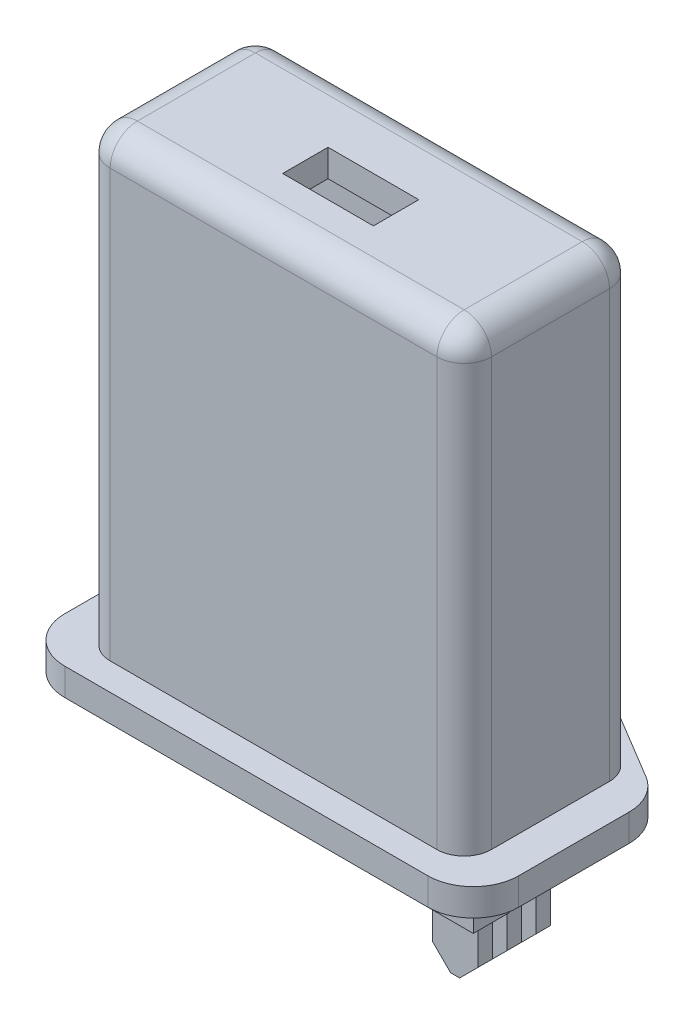
from build123d import *

# Parameters (mm, degrees)
BOSS_EXTRUDE1_DEPTH   = 0.3
EXTRUDE_THIN1_DEPTH   = 5
EXTRUDE_THIN1_2_DEPTH = 0.3
EXTRUDE_THIN1_START   = 4.7
EXTRUDE_THIN1_3_DEPTH = 0.3
FILLET2_R             = 0.3
CUT_EXTRUDE2_REACH    = 8.308
SKETCH5_W             = 1
SKETCH5_H             = 0.5
SKETCH6_W             = 0.7
SKETCH6_H             = 0.4
SKETCH6_W_2           = 0.5
SKETCH6_H_2           = 0.8
CUT_EXTRUDE3_DEPTH    = 0.2
CUT_EXTRUDE4_DEPTH    = 0.1
BOSS_EXTRUDE2_DEPTH   = 3
CHAMFER1_SIZE         = 0.2
SKETCH9_W             = 0.7
SKETCH9_H             = 0.4
BOSS_EXTRUDE3_DEPTH   = 1
SKETCH10_W            = 0.3
SKETCH10_H            = 0.2
CUT_EXTRUDE5_DEPTH    = 0.3
SKETCH11_R            = 0.07
CUT_EXTRUDE6_DEPTH    = 1


# Read off the part's stored shape, not the designer's step: Extrude-Thin1
with BuildPart() as part:
    # Sketch2 → Boss-Extrude1 (new body)
    with BuildSketch(Plane(origin=(0, 0, 0), x_dir=(1, 0, 0), z_dir=(0, 1, 0))):
        with BuildLine():
            Line((-2.257247878, 1.145651273), (-0.514495755, 2.191302547))
            ThreePointArc((-0.514495755, 2.191302547), (0, 2.333809621), (0.514495755, 2.191302547))
            Line((0.514495755, 2.191302547), (2.257247878, 1.145651273))
            ThreePointArc((2.257247878, 1.145651273), (2.435099953, 0.963254218), (2.5, 0.716904811))
            Line((2.5, 0.716904811), (2.5, -0.5))
            ThreePointArc((2.5, -0.5), (2.353553391, -0.853553391), (2, -1))
            Line((2, -1), (-2, -1))
            ThreePointArc((-2, -1), (-2.353553391, -0.853553391), (-2.5, -0.5))
            Line((-2.5, -0.5), (-2.5, 0.716904811))
            ThreePointArc((-2.5, 0.716904811), (-2.435099953, 0.963254218), (-2.257247878, 1.145651273))
        make_face()
    extrude(amount=BOSS_EXTRUDE1_DEPTH)

    # Extrude-Thin1 outline → Extrude-Thin1 (add)
    with BuildSketch(Plane(origin=(0, 0.3, 0), x_dir=(1, 0, 0), z_dir=(0, 1, 0))):
        with BuildLine():
            ThreePointArc((-1.8, 1.2), (-2.012132034, 1.112132034), (-2.1, 0.9))
            Line((-2.1, 0.9), (-2.1, -0.4))
            ThreePointArc((-2.1, -0.4), (-2.012132034, -0.612132034), (-1.8, -0.7))
            Line((-1.8, -0.7), (1.8, -0.7))
            ThreePointArc((1.8, -0.7), (2.012132034, -0.612132034), (2.1, -0.4))
            Line((2.1, -0.4), (2.1, 0.9))
            ThreePointArc((2.1, 0.9), (2.012132034, 1.112132034), (1.8, 1.2))
            Line((1.8, 1.2), (-1.8, 1.2))
        make_face()
        with BuildLine():
            Line((-2, -0.4), (-2, 0.9))
            ThreePointArc((-2, 0.9), (-1.941421356, 1.041421356), (-1.8, 1.1))
            Line((-1.8, 1.1), (1.8, 1.1))
            ThreePointArc((1.8, 1.1), (1.941421356, 1.041421356), (2, 0.9))
            Line((2, 0.9), (2, -0.4))
            ThreePointArc((2, -0.4), (1.941421356, -0.541421356), (1.8, -0.6))
            Line((1.8, -0.6), (-1.8, -0.6))
            ThreePointArc((-1.8, -0.6), (-1.941421356, -0.541421356), (-2, -0.4))
        make_face(mode=Mode.SUBTRACT)
    extrude(amount=EXTRUDE_THIN1_DEPTH)

    # Extrude-Thin1 2 outline → Extrude-Thin1 2 (add)
    with BuildSketch(Plane(origin=(0, 0.3, 0), x_dir=(1, 0, 0), z_dir=(0, 1, 0))):
        with BuildLine():
            ThreePointArc((-1.8, 1.1), (-1.941421356, 1.041421356), (-2, 0.9))
            Line((-2, 0.9), (-2, -0.4))
            ThreePointArc((-2, -0.4), (-1.941421356, -0.541421356), (-1.8, -0.6))
            Line((-1.8, -0.6), (1.8, -0.6))
            ThreePointArc((1.8, -0.6), (1.941421356, -0.541421356), (2, -0.4))
            Line((2, -0.4), (2, 0.9))
            ThreePointArc((2, 0.9), (1.941421356, 1.041421356), (1.8, 1.1))
            Line((1.8, 1.1), (-1.8, 1.1))
        make_face()
    extrude(amount=EXTRUDE_THIN1_2_DEPTH)

    # Extrude-Thin1 3 outline → Extrude-Thin1 3 (add)
    with BuildSketch(Plane(origin=(0, 0.3, 0), x_dir=(1, 0, 0), z_dir=(0, 1, 0)).offset(EXTRUDE_THIN1_START)):
        with BuildLine():
            ThreePointArc((-1.8, 1.1), (-1.941421356, 1.041421356), (-2, 0.9))
            Line((-2, 0.9), (-2, -0.4))
            ThreePointArc((-2, -0.4), (-1.941421356, -0.541421356), (-1.8, -0.6))
            Line((-1.8, -0.6), (1.8, -0.6))
            ThreePointArc((1.8, -0.6), (1.941421356, -0.541421356), (2, -0.4))
            Line((2, -0.4), (2, 0.9))
            ThreePointArc((2, 0.9), (1.941421356, 1.041421356), (1.8, 1.1))
            Line((1.8, 1.1), (-1.8, 1.1))
        make_face()
    extrude(amount=EXTRUDE_THIN1_3_DEPTH)

    # Fillet2
    fillet2_edges = [part.edges().sort_by_distance(p)[0] for p in [
        (2.1, 5.3, -0.25),
        (2.012132034, 5.3, -1.112132034),
        (0, 5.3, -1.2),
        (-2.012132034, 5.3, -1.112132034),
        (-2.1, 5.3, -0.25),
        (-2.012132034, 5.3, 0.612132034),
        (0, 5.3, 0.7),
        (2.012132034, 5.3, 0.612132034),
    ]]
    fillet(fillet2_edges, radius=FILLET2_R)

    # Sketch5 → Cut-Extrude2 (cut, up to next)
    with BuildSketch(Plane(origin=(0, 5.3, 0), x_dir=(1, 0, 0), z_dir=(0, 1, 0)), mode=Mode.PRIVATE) as cut_extrude2_sk1:
        with Locations((0, 0.15)):
            Rectangle(SKETCH5_W, SKETCH5_H)
    cut_extrude2_tool1 = extrude(cut_extrude2_sk1.sketch, amount=-CUT_EXTRUDE2_REACH, mode=Mode.PRIVATE) & part.part
    add(cut_extrude2_tool1.solids().sort_by_distance((0, 5.3, -0.15))[0], mode=Mode.SUBTRACT)

    # Sketch6 → Cut-Extrude3 (cut)
    with BuildSketch(Plane.XZ):
        with Locations((-1.35, 0)):
            Rectangle(SKETCH6_W, SKETCH6_H)
        with Locations((1.35, 0)):
            Rectangle(SKETCH6_W, SKETCH6_H)
        with Locations((0, -1.7)):
            Rectangle(SKETCH6_W_2, SKETCH6_H_2)
    extrude(amount=-CUT_EXTRUDE3_DEPTH, mode=Mode.SUBTRACT)

    # Sketch7 → Cut-Extrude4 (cut)
    with BuildSketch(Plane.XZ):
        with BuildLine():
            Line((-1.9, 0.9), (1.9, 0.9))
            ThreePointArc((1.9, 0.9), (2.253553391, 0.753553391), (2.4, 0.4))
            Line((2.4, 0.4), (2.4, -0.680159029))
            ThreePointArc((2.4, -0.680159029), (2.335099953, -0.926508436), (2.157247878, -1.108905491))
            Line((2.157247878, -1.108905491), (0.514495755, -2.094556765))
            ThreePointArc((0.514495755, -2.094556765), (0, -2.237063839), (-0.514495755, -2.094556765))
            Line((-0.514495755, -2.094556765), (-2.157247878, -1.108905491))
            ThreePointArc((-2.157247878, -1.108905491), (-2.335099953, -0.926508436), (-2.4, -0.680159029))
            Line((-2.4, -0.680159029), (-2.4, 0.4))
            ThreePointArc((-2.4, 0.4), (-2.253553391, 0.753553391), (-1.9, 0.9))
        make_face()
        with BuildLine():
            Line((-1.6, 0.7), (1.6, 0.7))
            ThreePointArc((1.6, 0.7), (1.953553391, 0.553553391), (2.1, 0.2))
            Line((2.1, 0.2), (2.1, -0.7))
            ThreePointArc((2.1, -0.7), (1.953553391, -1.053553391), (1.6, -1.2))
            Line((1.6, -1.2), (-1.6, -1.2))
            ThreePointArc((-1.6, -1.2), (-1.953553391, -1.053553391), (-2.1, -0.7))
            Line((-2.1, -0.7), (-2.1, 0.2))
            ThreePointArc((-2.1, 0.2), (-1.953553391, 0.553553391), (-1.6, 0.7))
        make_face(mode=Mode.SUBTRACT)
    extrude(amount=-CUT_EXTRUDE4_DEPTH, mode=Mode.SUBTRACT)

    # Sketch8 → Boss-Extrude2 (add)
    with BuildSketch(Plane.XZ.offset(-0.2)):
        Polygon((0.25, -1.46), (0.07, -1.46), (0.07, -1.62), (0.25, -1.62), (0.25, -1.78), (0.07, -1.78), (0.07, -1.94), (0.25, -1.94), (0.25, -2.1), (-0.25, -2.1), (-0.25, -1.94), (-0.07, -1.94), (-0.07, -1.78), (-0.25, -1.78), (-0.25, -1.62), (-0.07, -1.62), (-0.07, -1.46), (-0.25, -1.46), (-0.25, -1.3), (0.25, -1.3), align=None)
    extrude(amount=BOSS_EXTRUDE2_DEPTH)

    # Chamfer1
    # the kernel refuses this chamfer: 0.2 mm, written as the material it takes off along each edge
    with BuildSketch(Plane(origin=(-0.25, -2.8, -1.974336598), x_dir=(-0.027495876610586223, 0.9996219169112966, 0), z_dir=(0, 0, 1)), Plane(origin=(-0.25, -2.8, -2.294336598), x_dir=(-0.027495876610586223, 0.9996219169112966, 0), z_dir=(0, 0, 1)), Plane(origin=(-0.25, -2.8, -2.614336598), x_dir=(-0.027495876610586355, 0.9996219169112966, 0), z_dir=(0, 0, 1)), Plane(origin=(0.25, -2.8, -1.425663402), x_dir=(0.027495876610586223, 0.9996219169112966, 0), z_dir=(0, 0, -1)), Plane(origin=(0.25, -2.8, -1.105663402), x_dir=(0.027495876610586223, 0.9996219169112966, 0), z_dir=(0, 0, -1)), Plane(origin=(0.25, -2.8, -0.785663402), x_dir=(0.027495876610586223, 0.9996219169112966, 0), z_dir=(0, 0, -1))) as chamfer1_piece_1:
        Polygon((CHAMFER1_SIZE * 0.999621916911, -CHAMFER1_SIZE * 0.0274958766106), (-CHAMFER1_SIZE * 0.0274958766106, -CHAMFER1_SIZE * 0.999621916911), (0, 0), align=None)
    extrude(amount=1.188673195, mode=Mode.SUBTRACT)

    # Sketch9 → Boss-Extrude3 (add)
    with BuildSketch(Plane.XZ.offset(-0.2)):
        with Locations((1.35, 0)):
            Rectangle(SKETCH9_W, SKETCH9_H)
    boss_extrude3 = extrude(amount=BOSS_EXTRUDE3_DEPTH)

    # Sketch10 → Cut-Extrude5 (cut)
    with BuildSketch(Plane.XZ.offset(0.8)):
        with Locations((1.35, 0)):
            Rectangle(SKETCH10_W, SKETCH10_H)
        with Locations((-1.35, 0)):
            Rectangle(SKETCH10_W, SKETCH10_H)
    cut_extrude5 = extrude(amount=-CUT_EXTRUDE5_DEPTH, mode=Mode.SUBTRACT)

    # Sketch11 → Cut-Extrude6 (cut)
    with BuildSketch(Plane.XZ.offset(0.5)):
        with Locations(Location((1.35, 0, 0), (0, 0, 270))):
            Circle(SKETCH11_R)
    cut_extrude6 = extrude(amount=-CUT_EXTRUDE6_DEPTH, mode=Mode.SUBTRACT)

    # Mirror2: Boss-Extrude3, Cut-Extrude5, Cut-Extrude6 across plane
    add(boss_extrude3.mirror(Plane(origin=(0, 0, 0), x_dir=(0, 0, 1), z_dir=(1, 0, 0))))
    add(cut_extrude5.mirror(Plane(origin=(0, 0, 0), x_dir=(0, 0, 1), z_dir=(1, 0, 0))), mode=Mode.SUBTRACT)
    add(cut_extrude6.mirror(Plane(origin=(0, 0, 0), x_dir=(0, 0, 1), z_dir=(1, 0, 0))), mode=Mode.SUBTRACT)


solid = part.part
